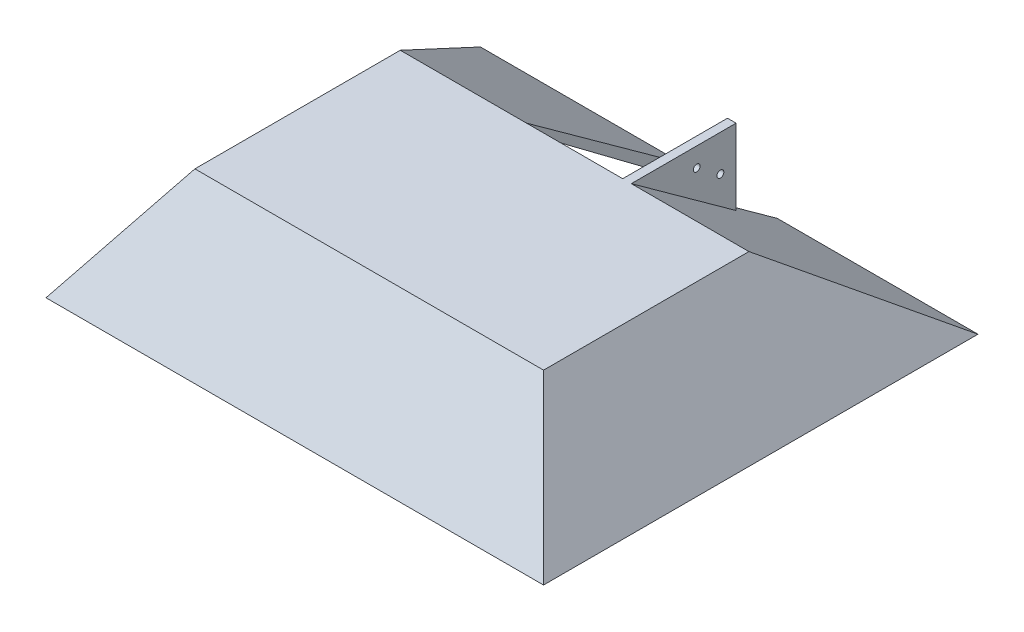
from build123d import *

# Parameters (mm, degrees)
CUT_EXTRUDE3_START      = -32.5
SKETCH7_W               = 100
SKETCH7_H               = 60
CUT_EXTRUDE3_DEPTH      = 30
CUT_EXTRUDE6_DEPTH      = 14
CUT_EXTRUDE6_DEPTH_BACK = 14
BOSS_EXTRUDE1_DEPTH     = 2.5
BOSS_EXTRUDE2_DEPTH     = 30
BOSS_EXTRUDE3_START     = -2.5
BOSS_EXTRUDE3_DEPTH     = 5
BOSS_EXTRUDE4_START     = -30
BOSS_EXTRUDE4_DEPTH     = 2.5
BOSS_EXTRUDE4_START_2   = 27.5
BOSS_EXTRUDE4_2_DEPTH   = 2.5
BOSS_EXTRUDE5_START     = -30
BOSS_EXTRUDE5_DEPTH     = 2.5
BOSS_EXTRUDE5_START_2   = 27.5
BOSS_EXTRUDE5_2_DEPTH   = 2.5
SKETCH20_W              = 100
SKETCH20_H              = 60
CUT_EXTRUDE7_DEPTH      = 2.5
CUT_EXTRUDE8_START      = -2.5
SKETCH21_R              = 2.627
CUT_EXTRUDE8_DEPTH      = 100
SKETCH13_R              = 1
CUT_EXTRUDE9_DEPTH      = 2.5
CUT_EXTRUDE11_START     = -1.2
SKETCH23_W              = 181.319522923
SKETCH23_H              = 53.809633396
CUT_EXTRUDE11_DEPTH     = 4
SKETCH24_R              = 2.5
BOSS_EXTRUDE6_DEPTH     = 2.5
SKETCH25_R              = 1
CUT_EXTRUDE12_DEPTH     = 2.5
CUT_EXTRUDE13_START     = -2
SKETCH26_W              = 145.47086515
SKETCH26_H              = 58.938684545
CUT_EXTRUDE13_DEPTH     = 2.5
CUT_EXTRUDE14_START     = -2
SKETCH27_W              = 157.368673289
SKETCH27_H              = 83.270010287
CUT_EXTRUDE14_DEPTH     = 2.5


# Read off the part's stored shape, not the designer's step: Boss-Extrude3, Boss-Extrude4, Boss-Extrude5
with BuildPart() as part:
    # Sketch1 → Loft1 section 0
    with BuildSketch(Plane(origin=(0, 0, 0), x_dir=(1, 0, 0), z_dir=(0, 1, 0))):
        with BuildLine():
            Line((-75, -55), (-75, 75))
            Line((-75, 75), (75, 75))
            Line((75, 75), (75, -55))
            Line((75, -55), (-75, -55))
        make_face()
    # Sketch2 → Loft1 section 1
    with BuildSketch(Plane(origin=(0, 32.5, 0), x_dir=(1, 0, 0), z_dir=(0, 1, 0))):
        with BuildLine():
            Line((-52.5, -30), (52.5, -30))
            Line((52.5, -30), (52.5, 30))
            Line((52.5, 30), (-52.5, 30))
            Line((-52.5, 30), (-52.5, -30))
        make_face()
    loft()

    # Sketch7 → Cut-Extrude3 (cut)
    with BuildSketch(Plane(origin=(0, 32.5, 0), x_dir=(1, 0, 0), z_dir=(0, 1, 0)).offset(CUT_EXTRUDE3_START)):
        Rectangle(SKETCH7_W, SKETCH7_H)
    extrude(amount=CUT_EXTRUDE3_DEPTH, mode=Mode.SUBTRACT)

    # Sketch8 → Cut-Extrude6 (cut, two sides: drawn at the far end of the back side and taken through both)
    with BuildSketch(Plane(origin=(0, 0, 0), x_dir=(0, 0, -1), z_dir=(1, 0, 0)).offset(-CUT_EXTRUDE6_DEPTH_BACK)):
        Polygon((30, 35.583833793), (79.269923714, 0), (30, 0), align=None)
    extrude(amount=CUT_EXTRUDE6_DEPTH + CUT_EXTRUDE6_DEPTH_BACK, mode=Mode.SUBTRACT)

    # Sketch11 → Cut-Loft1 section 0
    with BuildSketch(Plane.XZ.offset(-30)):
        with BuildLine():
            Line((-50, 30), (50, 30))
            Line((50, 30), (50, -30))
            Line((50, -30), (-50, -30))
            Line((-50, -30), (-50, 30))
        make_face()
    # Sketch9 → Cut-Loft1 section 1
    with BuildSketch(Plane.XZ):
        with BuildLine():
            Line((-70, 50), (70, 50))
            Line((70, 50), (70, -70))
            Line((70, -70), (-70, -70))
            Line((-70, -70), (-70, 50))
        make_face()
    loft(mode=Mode.SUBTRACT)

    # Sketch12 → Boss-Extrude1 (add)
    with BuildSketch(Plane.ZY.offset(-14)):
        Polygon((-60.5, 32.5), (-60.5, 10.472222222), (-30, 32.5), align=None)
    extrude(amount=-BOSS_EXTRUDE1_DEPTH)

    # Sketch14 → Boss-Extrude2 (add)
    with BuildSketch(Plane.XZ.offset(-30)):
        Polygon((-50, -30), (-50, 30), (50, 30), (50, -30), (14, -30), (14, -28.75), (47.5, -28.75), (47.5, -7.5), (22.5, -7.5), (22.5, -6.25), (47.5, -6.25), (47.5, 6.25), (22.5, 6.25), (22.5, 7.5), (47.5, 7.5), (47.5, 28.75), (-47.5, 28.75), (-47.5, 7.5), (-22.5, 7.5), (-22.5, 6.25), (-47.5, 6.25), (-47.5, -6.25), (-22.5, -6.25), (-22.5, -7.5), (-47.5, -7.5), (-47.5, -28.75), (-14, -28.75), (-14, -30), (-47.5, -30), align=None)
    extrude(amount=BOSS_EXTRUDE2_DEPTH)

    # Boss-Extrude3 outline → Boss-Extrude3 (add)
    with BuildSketch(Plane.YZ.offset(BOSS_EXTRUDE3_START)):
        Polygon((30, 30), (0, 50), (0, 30), align=None)
    extrude(amount=BOSS_EXTRUDE3_DEPTH)

    # Boss-Extrude4 outline → Boss-Extrude4 (add)
    with BuildSketch(Plane.XY.offset(BOSS_EXTRUDE4_START)):
        Polygon((-50, 30), (-70, 0), (-50, 0), align=None)
    extrude(amount=BOSS_EXTRUDE4_DEPTH)

    # Boss-Extrude4 2 outline → Boss-Extrude4 2 (add)
    with BuildSketch(Plane.XY.offset(BOSS_EXTRUDE4_START_2)):
        Polygon((-50, 30), (-70, 0), (-50, 0), align=None)
    extrude(amount=BOSS_EXTRUDE4_2_DEPTH)

    # Boss-Extrude5 outline → Boss-Extrude5 (add)
    with BuildSketch(Plane.XY.offset(BOSS_EXTRUDE5_START)):
        Polygon((50, 30), (50, 0), (70, 0), align=None)
    extrude(amount=BOSS_EXTRUDE5_DEPTH)

    # Boss-Extrude5 2 outline → Boss-Extrude5 2 (add)
    with BuildSketch(Plane.XY.offset(BOSS_EXTRUDE5_START_2)):
        Polygon((50, 30), (50, 0), (70, 0), align=None)
    extrude(amount=BOSS_EXTRUDE5_2_DEPTH)

    # Sketch20 → Cut-Extrude7 (cut)
    with BuildSketch(Plane.XZ):
        Rectangle(SKETCH20_W, SKETCH20_H)
    extrude(amount=-CUT_EXTRUDE7_DEPTH, mode=Mode.SUBTRACT)

    # Sketch21 → Cut-Extrude8 (cut)
    with BuildSketch(Plane(origin=(-47.5, 0, 0), x_dir=(0, 0, -1), z_dir=(1, 0, 0)).offset(CUT_EXTRUDE8_START)):
        with Locations(Location((0, 7.5, 0), (0, 0, 180))):
            Circle(SKETCH21_R)
    extrude(amount=CUT_EXTRUDE8_DEPTH, mode=Mode.SUBTRACT)

    # Sketch13 → Cut-Extrude9 (cut)
    with BuildSketch(Plane(origin=(16.5, 0, 0), x_dir=(0, 0, -1), z_dir=(1, 0, 0))):
        with Locations((55.923446724, 21.955394633)):
            Circle(SKETCH13_R)
        with Locations((49.044605367, 26.923446724)):
            Circle(SKETCH13_R)
    extrude(amount=-CUT_EXTRUDE9_DEPTH, mode=Mode.SUBTRACT)

    # Sketch23 → Cut-Extrude11 (cut)
    with BuildSketch(Plane(origin=(0, 23.076923077, 34.615384615), x_dir=(-1, 0, 0), z_dir=(0, -0.5547001962252286, -0.8320502943378442)).offset(CUT_EXTRUDE11_START)):
        with Locations((-1.646246513, -10.343211106)):
            Rectangle(SKETCH23_W, SKETCH23_H)
    extrude(amount=-CUT_EXTRUDE11_DEPTH, mode=Mode.SUBTRACT)

    # Sketch24 → Boss-Extrude6 (add)
    with BuildSketch(Plane.XZ.offset(-2.5)):
        with Locations((-47.5, -27.5)):
            Circle(SKETCH24_R)
        with Locations((47.5, 27.5)):
            Circle(SKETCH24_R)
    extrude(amount=-BOSS_EXTRUDE6_DEPTH)

    # Sketch25 → Cut-Extrude12 (cut)
    with BuildSketch(Plane.XZ.offset(-2.5)):
        with Locations(Location((-47.5, -27.5, 0), (0, 0, 270))):
            Circle(SKETCH25_R)
        with Locations(Location((47.5, 27.5, 0), (0, 0, 270))):
            Circle(SKETCH25_R)
    extrude(amount=-CUT_EXTRUDE12_DEPTH, mode=Mode.SUBTRACT)

    # Sketch26 → Cut-Extrude13 (cut)
    with BuildSketch(Plane(origin=(-48.461538462, 32.307692308, 0), x_dir=(0, 0, -1), z_dir=(0.8320502943378436, -0.5547001962252295, 0)).offset(CUT_EXTRUDE13_START)):
        with Locations((11.121253107, -16.230406727)):
            Rectangle(SKETCH26_W, SKETCH26_H)
    extrude(amount=-CUT_EXTRUDE13_DEPTH, mode=Mode.SUBTRACT)

    # Sketch27 → Cut-Extrude14 (cut)
    with BuildSketch(Plane(origin=(48.461538462, 32.307692308, 0), x_dir=(0, 0, 1), z_dir=(-0.8320502943378442, -0.5547001962252287, 0)).offset(CUT_EXTRUDE14_START)):
        with Locations((-8.576197042, -8.380711465)):
            Rectangle(SKETCH27_W, SKETCH27_H)
    extrude(amount=-CUT_EXTRUDE14_DEPTH, mode=Mode.SUBTRACT)


solid = part.part
